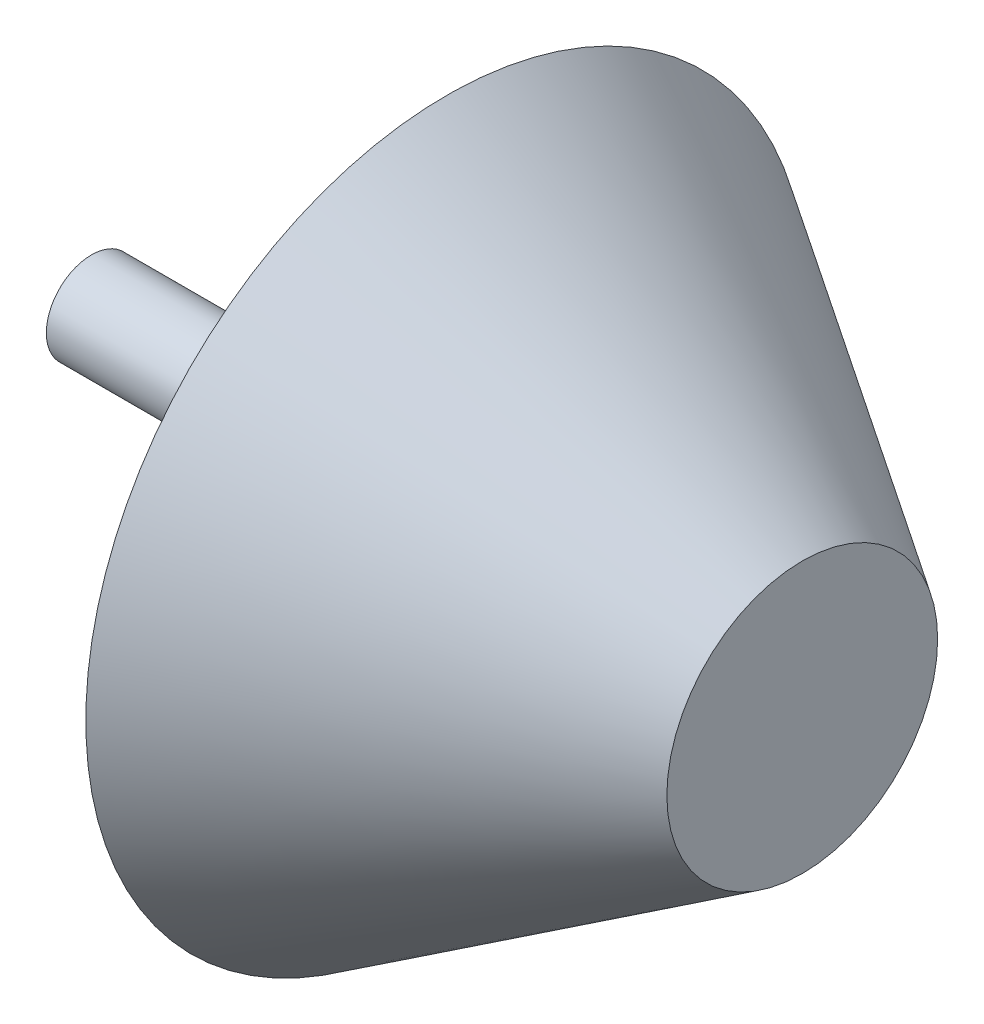
from build123d import *

# Parameters (mm, degrees)
SKETCH2_R           = 101.6
SKETCH3_R           = 38.1
SKETCH4_R           = 12.7
BOSS_EXTRUDE1_DEPTH = 100


with BuildPart() as part:
    # Sketch2 → Loft1 section 0
    with BuildSketch(Plane.YZ):
        Circle(SKETCH2_R)
    # Sketch3 → Loft1 section 1
    with BuildSketch(Plane.YZ.offset(100)):
        Circle(SKETCH3_R)
    loft()

    # Sketch4 → Boss-Extrude1 (add)
    with BuildSketch(Plane(origin=(0, 0, 0), x_dir=(0, -1, 0), z_dir=(-1, 0, 0))):
        Circle(SKETCH4_R)
    extrude(amount=BOSS_EXTRUDE1_DEPTH)


solid = part.part
